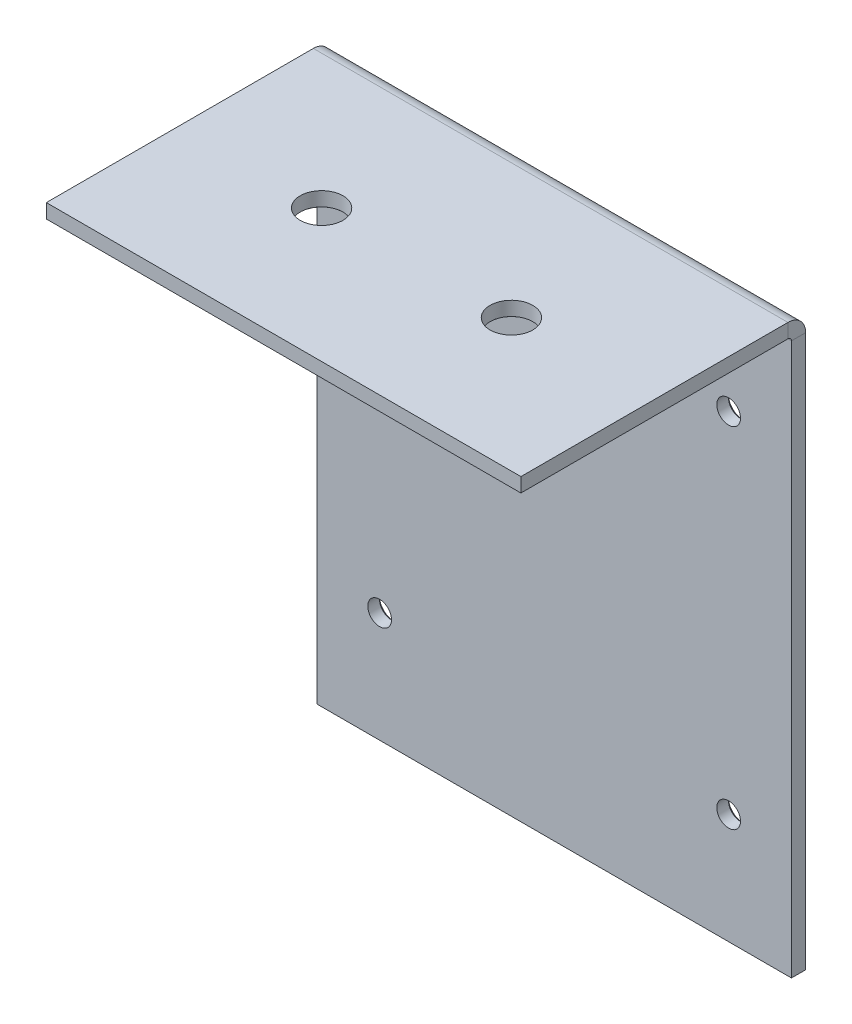
from build123d import *

# Parameters (mm, degrees)
SKETCH_1_W                       = 100
SKETCH_1_H                       = 120
SM_BASE_FLANGE_1_DEPTH           = 3
SM_EDGE_FLANGE_1_STRIP_W         = 13.4732
SM_EDGE_FLANGE_1_STRIP_H         = 3
SM_EDGE_FLANGE_1_STRIP_CUT_DEPTH = 100
SM_EDGE_FLANGE_1_DEPTH           = 100
HOLE_WIZARD_M6_2_D               = 5
HOLE_WIZARD_M6_2_DEPTH           = 15
HOLE_WIZARD_M6_2_CSINK_D         = 6.05
HOLE_WIZARD_M6_2_CSINK_ANGLE     = 90
HOLE_WIZARD_M6_2_TIP             = 1.502151548
HOLE_WIZARD_M8_1_D               = 9
HOLE_WIZARD_M8_1_DEPTH           = 15
HOLE_WIZARD_M8_1_CSINK_D         = 9.05
HOLE_WIZARD_M8_1_CSINK_ANGLE     = 90
HOLE_WIZARD_M8_1_TIP             = 2.703872786


# Sheet-metal steps are written as plain solids
with BuildPart() as part:
    # Sketch 1 → 基体-法兰1 (new body)
    with BuildSketch(Plane.XY):
        Rectangle(SKETCH_1_W, SKETCH_1_H)
    extrude(amount=-SM_BASE_FLANGE_1_DEPTH)

    # 边线-法兰1 strip (across the edge) → 边线-法兰1 strip cut (cut)
    with BuildSketch(Plane(origin=(50, 60, 0), x_dir=(0, -1, 0), z_dir=(-1, 0, 0))):
        with Locations((-3, -1.5)):
            Rectangle(SM_EDGE_FLANGE_1_STRIP_W, SM_EDGE_FLANGE_1_STRIP_H)
    extrude(amount=SM_EDGE_FLANGE_1_STRIP_CUT_DEPTH, mode=Mode.SUBTRACT)

    # 边线-法兰1 section (across the edge) → 边线-法兰1 (add)
    with BuildSketch(Plane(origin=(50, 60, 0), x_dir=(0, -1, 0), z_dir=(-1, 0, 0))):
        with BuildLine():
            Line((0, 0.7366), (0, 57))
            Line((0, 57), (3, 57))
            Line((3, 57), (3, 0.7366))
            ThreePointArc((3, 0.7366), (3.215745145, 0.215745145), (3.7366, 0))
            Line((3.7366, 0), (3.7366, -3))
            ThreePointArc((3.7366, -3), (1.094424801, -1.905575199), (0, 0.7366))
        make_face()
    extrude(amount=SM_EDGE_FLANGE_1_DEPTH)

    # M6 螺纹孔2
    with Locations(Plane(origin=(0, 0, -3), x_dir=(-1, 0, 0), z_dir=(0, 0, -1))):
        with Locations((-36.77, 36.77), (36.77, 36.77), (36.77, -36.77), (-36.77, -36.77)):
            CounterSinkHole(HOLE_WIZARD_M6_2_D / 2, HOLE_WIZARD_M6_2_CSINK_D / 2, depth=HOLE_WIZARD_M6_2_DEPTH, counter_sink_angle=HOLE_WIZARD_M6_2_CSINK_ANGLE)
            with Locations((0, 0, -(HOLE_WIZARD_M6_2_DEPTH + HOLE_WIZARD_M6_2_TIP / 2))):  # 118° drill point
                Cone(0, HOLE_WIZARD_M6_2_D / 2, HOLE_WIZARD_M6_2_TIP, mode=Mode.SUBTRACT)

    # M8 间隙孔1
    with Locations(Plane(origin=(0, 57, 0), x_dir=(-1, 0, 0), z_dir=(0, -1, 0))):
        with Locations((20, -29), (-20, -29)):
            CounterSinkHole(HOLE_WIZARD_M8_1_D / 2, HOLE_WIZARD_M8_1_CSINK_D / 2, depth=HOLE_WIZARD_M8_1_DEPTH, counter_sink_angle=HOLE_WIZARD_M8_1_CSINK_ANGLE)
            with Locations((0, 0, -(HOLE_WIZARD_M8_1_DEPTH + HOLE_WIZARD_M8_1_TIP / 2))):  # 118° drill point
                Cone(0, HOLE_WIZARD_M8_1_D / 2, HOLE_WIZARD_M8_1_TIP, mode=Mode.SUBTRACT)


solid = part.part
